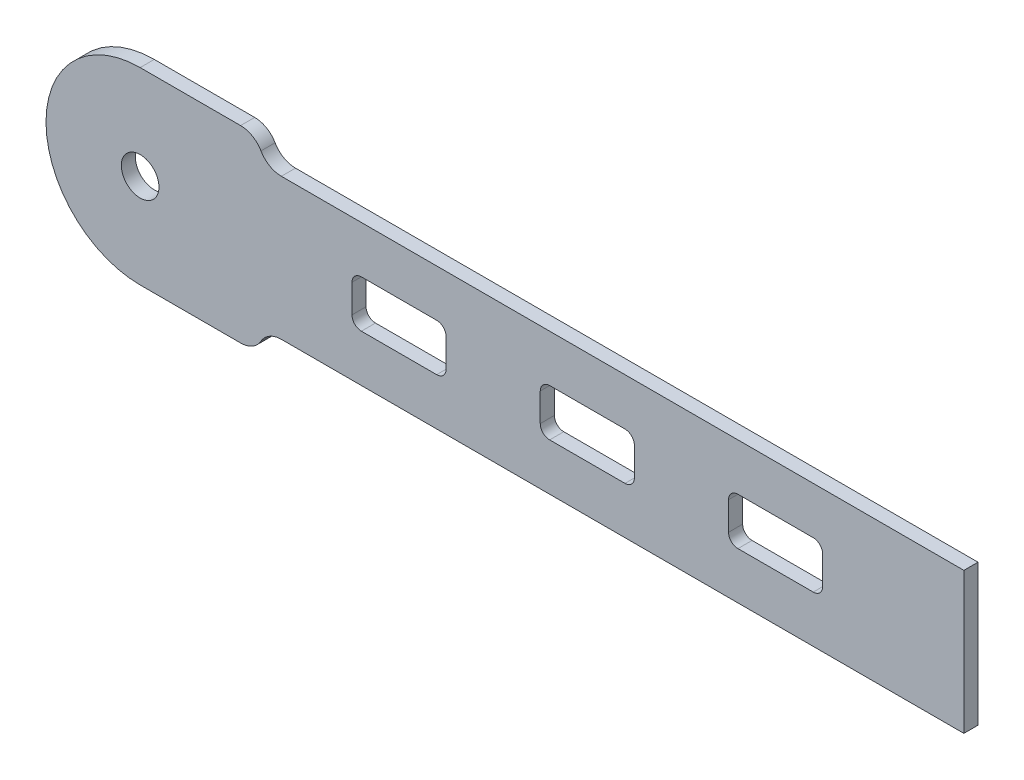
from build123d import *

# Parameters (mm, degrees)
SKETCH1_R           = 4
BOSS_EXTRUDE1_DEPTH = 3
FILLET1_R           = 5
SKETCH2_W           = 20
SKETCH2_H           = 10
CUT_EXTRUDE1_DEPTH  = 3
FILLET2_R           = 2
CUT_EXTRUDE3_DEPTH  = 3
FILLET4_R           = 5


with BuildPart() as part:
    # Sketch1 → Boss-Extrude1 (new body)
    with BuildSketch(Plane.XY):
        Polygon((-50, -25), (-50, -15), (100, -15), (100, 15), (-50, 15), (-50, 25), (-100, 25), (-100, -25), align=None)
        with Locations((-75, 0)):
            Circle(SKETCH1_R, mode=Mode.SUBTRACT)
    extrude(amount=BOSS_EXTRUDE1_DEPTH)

    # Fillet1
    fillet1_edges = [part.edges().sort_by_distance(p)[0] for p in [
        (-50, -15, 1.5),
        (-50, 15, 1.5),
    ]]
    fillet(fillet1_edges, radius=FILLET1_R)
    fillet1_2_edges = [part.edges().sort_by_distance(p)[0] for p in [
        (-50, -25, 1.5),
        (-50, 25, 1.5),
    ]]
    fillet(fillet1_2_edges, radius=FILLET1_R - 0.0001)  # a hair under: the kernel refuses the full size

    # Sketch2 → Cut-Extrude1 (cut)
    with BuildSketch(Plane(origin=(0, 0, 0), x_dir=(-1, 0, 0), z_dir=(0, 0, -1))):
        with Locations((20, 0)):
            Rectangle(SKETCH2_W, SKETCH2_H)
        with Locations((-20, 0)):
            Rectangle(SKETCH2_W, SKETCH2_H)
        with Locations((-60, 0)):
            Rectangle(SKETCH2_W, SKETCH2_H)
    extrude(amount=-CUT_EXTRUDE1_DEPTH, mode=Mode.SUBTRACT)

    # Fillet2
    fillet2_edges = [part.edges().sort_by_distance(p)[0] for p in [
        (-30, -5, 1.5),
        (-10, -5, 1.5),
        (-10, 5, 1.5),
        (-30, 5, 1.5),
        (30, 5, 1.5),
        (10, 5, 1.5),
        (10, -5, 1.5),
        (30, -5, 1.5),
        (70, 5, 1.5),
        (50, 5, 1.5),
        (50, -5, 1.5),
        (70, -5, 1.5),
    ]]
    fillet(fillet2_edges, radius=FILLET2_R)

    # Sketch3 → Cut-Extrude3 (cut)
    with BuildSketch(Plane(origin=(0, 0, 0), x_dir=(-1, 0, 0), z_dir=(0, 0, -1))):
        with BuildLine():
            ThreePointArc((75, -20), (95, 0), (75, 20))
            Line((75, 20), (50, 20))
            ThreePointArc((50, 20), (51.464466094, 23.535533906), (55, 25))
            Line((55, 25), (100, 25))
            Line((100, 25), (100, -25))
            Line((100, -25), (55, -25))
            ThreePointArc((55, -25), (51.464466094, -23.535533906), (50, -20))
            Line((50, -20), (75, -20))
        make_face()
    extrude(amount=-CUT_EXTRUDE3_DEPTH, mode=Mode.SUBTRACT)


with BuildPart() as cut_extrude3_kept_piece:
    # of the separate pieces the step leaves, the one the design keeps (cut_extrude3_pieces_kept)
    add(part.part.solids().sort_by_distance((-50, -20, 0))[0])

    # Fillet4
    fillet4_edges = [cut_extrude3_kept_piece.edges().sort_by_distance(p)[0] for p in [
        (-50, -20, 1.5),
        (-50, 20, 1.5),
    ]]
    fillet(fillet4_edges, radius=FILLET4_R)


solid = cut_extrude3_kept_piece.part
